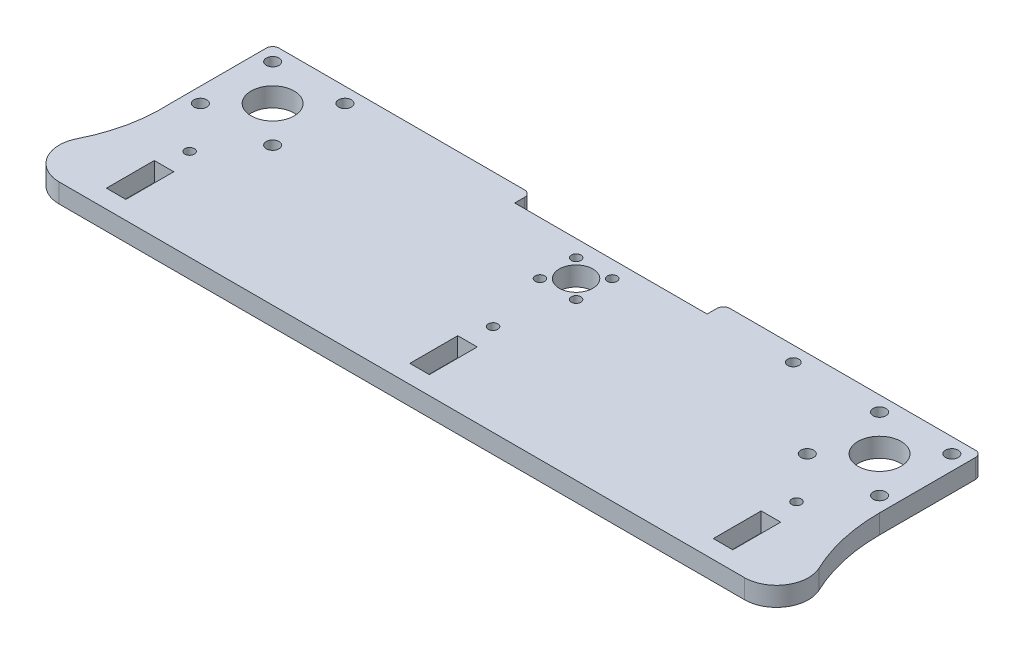
from build123d import *

# Parameters (mm, degrees)
CROQUIS1_W              = 6.1
CROQUIS1_H              = 15
CROQUIS1_R              = 1.5
CROQUIS1_R_2            = 2
CROQUIS1_R_3            = 6.75
CROQUIS1_R_4            = 5.25
CROQUIS1_R_5            = 1.75
SALIENTE_EXTRUIR1_DEPTH = 6


with BuildPart() as part:
    # Croquis1 → Saliente-Extruir1 (new body)
    with BuildSketch(Plane(origin=(0, 0, 0), x_dir=(1, 0, 0), z_dir=(0, 1, 0))):
        with BuildLine():
            Line((71.802987861, 43.644609037), (16.282727366, 43.644609037))
            ThreePointArc((16.282727366, 43.644609037), (14.868513803, 43.058822599), (14.282727366, 41.644609037))
            Line((14.282727366, 41.644609037), (14.282727366, 38.554619052))
            Line((14.282727366, 38.554619052), (-45.948026983, 38.554619052))
            Line((-45.948026983, 38.554619052), (-45.948026983, 41.644609037))
            ThreePointArc((-45.948026983, 41.644609037), (-46.533813421, 43.058822599), (-47.948026983, 43.644609037))
            Line((-47.948026983, 43.644609037), (-60.497048313, 43.644609037))
            Line((-60.497048313, 43.644609037), (-103.468287478, 43.644609037))
            Line((-103.468287478, 43.644609037), (-124.832649809, 43.644609037))
            ThreePointArc((-124.832649809, 43.644609037), (-126.246863371, 43.058822599), (-126.832649809, 41.644609037))
            Line((-126.832649809, 41.644609037), (-126.832649809, 27.644609037))
            Line((-126.832649809, 27.644609037), (-126.832649809, 11.644653108))
            ThreePointArc((-126.832649809, 11.644653108), (-127.777809493, -0.78872644), (-131.892437156, -12.559541748))
            ThreePointArc((-131.892437156, -12.559541748), (-131.47488844, -22.30230199), (-122.960915675, -27.057088195))
            Line((-122.960915675, -27.057088195), (91.620792474, -27.057088195))
            ThreePointArc((91.620792474, -27.057088195), (100.070791822, -22.404752266), (100.658344058, -12.7765904))
            ThreePointArc((100.658344058, -12.7765904), (96.557023393, -0.870818798), (95.167350191, 11.644653108))
            Line((95.167350191, 11.644653108), (95.167350191, 41.644609037))
            ThreePointArc((95.167350191, 41.644609037), (94.581563754, 43.058822599), (93.167350191, 43.644609037))
            Line((93.167350191, 43.644609037), (71.802987861, 43.644609037))
        make_face()
        with Locations((-110.832649809, -13.855390963)):
            Rectangle(CROQUIS1_W, CROQUIS1_H, mode=Mode.SUBTRACT)
        Polygon((-18.882640037, -21.355351899), (-18.88264641, -6.355351899), (-12.78264641, -6.355349308), (-12.782640037, -21.355349308), align=None, mode=Mode.SUBTRACT)
        with Locations((-110.832649809, 1.644609037)):
            Circle(CROQUIS1_R, mode=Mode.SUBTRACT)
        with Locations((-15.828049724, 1.644627362)):
            Circle(CROQUIS1_R, mode=Mode.SUBTRACT)
        Polygon((76.117371009, -21.355351899), (76.117364636, -6.355351899), (82.217364636, -6.355349308), (82.217371009, -21.355349308), align=None, mode=Mode.SUBTRACT)
        with Locations((79.167361237, 1.644649397)):
            Circle(CROQUIS1_R, mode=Mode.SUBTRACT)
        with Locations((-122.146358308, 16.330900538)):
            Circle(CROQUIS1_R_2, mode=Mode.SUBTRACT)
        with Locations((-99.51894131, 16.330900538)):
            Circle(CROQUIS1_R_2, mode=Mode.SUBTRACT)
        with Locations((-21.489504058, 21.987754787)):
            Circle(CROQUIS1_R, mode=Mode.SUBTRACT)
        with Locations((-110.832649809, 27.644609037)):
            Circle(CROQUIS1_R_3, mode=Mode.SUBTRACT)
        with Locations((-122.146358308, 38.958317536)):
            Circle(CROQUIS1_R_2, mode=Mode.SUBTRACT)
        with Locations((-99.51894131, 38.958317536)):
            Circle(CROQUIS1_R_2, mode=Mode.SUBTRACT)
        with Locations((-15.832649809, 27.644609037)):
            Circle(CROQUIS1_R_4, mode=Mode.SUBTRACT)
        with Locations((-21.489504058, 33.301463286)):
            Circle(CROQUIS1_R, mode=Mode.SUBTRACT)
        with Locations((-10.175795559, 21.987754787)):
            Circle(CROQUIS1_R, mode=Mode.SUBTRACT)
        with Locations((67.853641692, 16.330900538)):
            Circle(CROQUIS1_R_2, mode=Mode.SUBTRACT)
        with Locations((90.48105869, 16.330900538)):
            Circle(CROQUIS1_R_2, mode=Mode.SUBTRACT)
        with Locations((-10.175795559, 33.301463286)):
            Circle(CROQUIS1_R, mode=Mode.SUBTRACT)
        with Locations((40.853641692, 38.958317536)):
            Circle(CROQUIS1_R_5, mode=Mode.SUBTRACT)
        with Locations((79.167350191, 27.644609037)):
            Circle(CROQUIS1_R_3, mode=Mode.SUBTRACT)
        with Locations((67.853641692, 38.958317536)):
            Circle(CROQUIS1_R_2, mode=Mode.SUBTRACT)
        with Locations((90.48105869, 38.958317536)):
            Circle(CROQUIS1_R_2, mode=Mode.SUBTRACT)
    extrude(amount=SALIENTE_EXTRUIR1_DEPTH)


solid = part.part
